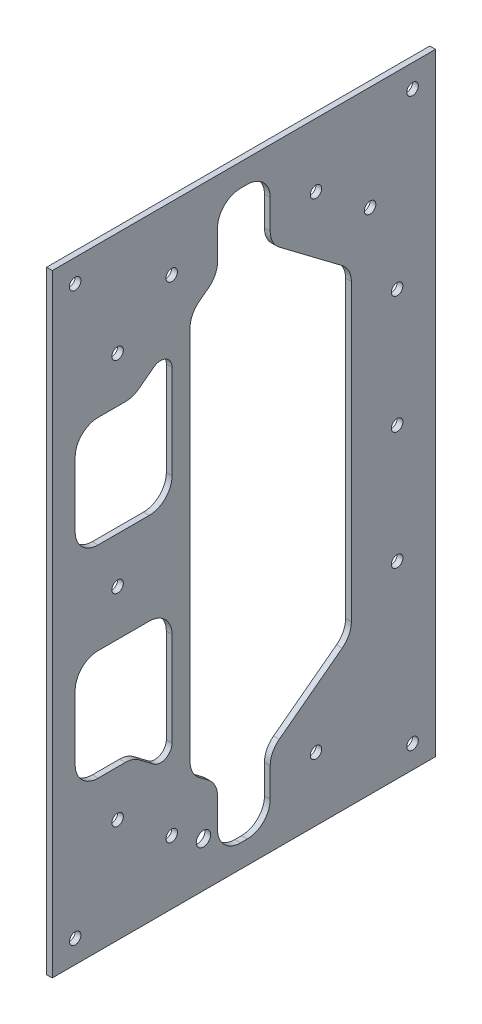
from build123d import *

# Parameters (mm, degrees)
SKETCH1_W           = 212.5
SKETCH1_H           = 339.725
SKETCH1_R           = 3.175
BOSS_EXTRUDE1_DEPTH = 3.175
CUT_EXTRUDE1_DEPTH  = 401.72360331
CUT_EXTRUDE2_DEPTH  = 13.97
BOSS_EXTRUDE2_START = -3.175
BOSS_EXTRUDE2_DEPTH = 3.175


with BuildPart() as part:
    # Sketch1 → Boss-Extrude1 (new body)
    with BuildSketch(Plane(origin=(0, 0, 0), x_dir=(0, 0, -1), z_dir=(1, 0, 0))):
        with Locations((106.25, -169.8625)):
            Rectangle(SKETCH1_W, SKETCH1_H)
        with Locations((12.7, -12.7)):
            Circle(SKETCH1_R, mode=Mode.SUBTRACT)
        with Locations((199.8, -12.7)):
            Circle(SKETCH1_R, mode=Mode.SUBTRACT)
        with Locations((66.25, -35.2425)):
            Circle(SKETCH1_R, mode=Mode.SUBTRACT)
        with Locations((146.25, -35.2425)):
            Circle(SKETCH1_R, mode=Mode.SUBTRACT)
        with Locations((176.25, -57.8625)):
            Circle(SKETCH1_R, mode=Mode.SUBTRACT)
        with Locations((36.25, -57.8625)):
            Circle(SKETCH1_R, mode=Mode.SUBTRACT)
        with Locations((191.25, -104.5325)):
            Circle(SKETCH1_R, mode=Mode.SUBTRACT)
        with Locations((36.25, -169.8625)):
            Circle(SKETCH1_R, mode=Mode.SUBTRACT)
        with Locations((191.25, -169.8625)):
            Circle(SKETCH1_R, mode=Mode.SUBTRACT)
        with Locations((36.25, -281.8625)):
            Circle(SKETCH1_R, mode=Mode.SUBTRACT)
        with Locations((66.25, -304.4825)):
            Circle(SKETCH1_R, mode=Mode.SUBTRACT)
        with Locations((12.7, -327.025)):
            Circle(SKETCH1_R, mode=Mode.SUBTRACT)
        with Locations((199.8, -327.025)):
            Circle(SKETCH1_R, mode=Mode.SUBTRACT)
        with Locations((146.25, -304.4825)):
            Circle(SKETCH1_R, mode=Mode.SUBTRACT)
        with Locations((191.25, -235.1925)):
            Circle(SKETCH1_R, mode=Mode.SUBTRACT)
    extrude(amount=BOSS_EXTRUDE1_DEPTH)

    # Sketch2 → Cut-Extrude1 (cut, through all)
    with BuildSketch(Plane(origin=(3.175, 0, 0), x_dir=(0, 0, -1), z_dir=(1, 0, 0))):
        with BuildLine():
            Line((165.85, -251.563304242), (165.85, -88.161695758))
            ThreePointArc((165.85, -88.161695758), (164.516472011, -82.49659964), (160.795934799, -78.021198677))
            Line((160.795934799, -78.021198677), (125.904065201, -51.712729))
            ThreePointArc((125.904065201, -51.712729), (122.183527989, -47.237328037), (120.85, -41.572231919))
            Line((120.85, -41.572231919), (120.85, -25.4))
            ThreePointArc((120.85, -25.4), (117.130256121, -16.419743879), (108.15, -12.7))
            Line((108.15, -12.7), (104.35, -12.7))
            ThreePointArc((104.35, -12.7), (95.369743879, -16.419743879), (91.65, -25.4))
            Line((91.65, -25.4), (91.65, -41.572231919))
            ThreePointArc((91.65, -41.572231919), (90.316472011, -47.237328037), (86.595934799, -51.712729))
            Line((86.595934799, -51.712729), (61.65, -70.521963839))
            Line((61.65, -70.521963839), (48.147303392, -80.702997081))
            ThreePointArc((48.147303392, -80.702997081), (44.532850149, -82.605637318), (40.501368593, -83.2625))
            Line((40.501368593, -83.2625), (25.4, -83.2625))
            ThreePointArc((25.4, -83.2625), (16.419743879, -86.982243879), (12.7, -95.9625))
            Line((12.7, -95.9625), (12.7, -131.7625))
            ThreePointArc((12.7, -131.7625), (16.419743879, -140.742756121), (25.4, -144.4625))
            Line((25.4, -144.4625), (48.95, -144.4625))
            ThreePointArc((48.95, -144.4625), (57.930256121, -148.182243879), (61.65, -157.1625))
            Line((61.65, -157.1625), (61.65, -182.5625))
            ThreePointArc((61.65, -182.5625), (57.930256121, -191.542756121), (48.95, -195.2625))
            Line((48.95, -195.2625), (25.4, -195.2625))
            ThreePointArc((25.4, -195.2625), (16.419743879, -198.982243879), (12.7, -207.9625))
            Line((12.7, -207.9625), (12.7, -243.7625))
            ThreePointArc((12.7, -243.7625), (16.419743879, -252.742756121), (25.4, -256.4625))
            Line((25.4, -256.4625), (40.501368593, -256.4625))
            ThreePointArc((40.501368593, -256.4625), (44.532850149, -257.119362682), (48.147303392, -259.022002919))
            Line((48.147303392, -259.022002919), (61.65, -269.203036161))
            Line((61.65, -269.203036161), (86.595934799, -288.012271))
            ThreePointArc((86.595934799, -288.012271), (90.316472011, -292.487671963), (91.65, -298.152768081))
            Line((91.65, -298.152768081), (91.65, -314.325))
            ThreePointArc((91.65, -314.325), (95.369743879, -323.305256121), (104.35, -327.025))
            Line((104.35, -327.025), (108.15, -327.025))
            ThreePointArc((108.15, -327.025), (117.130256121, -323.305256121), (120.85, -314.325))
            Line((120.85, -314.325), (120.85, -298.152768081))
            ThreePointArc((120.85, -298.152768081), (122.183527989, -292.487671963), (125.904065201, -288.012271))
            Line((125.904065201, -288.012271), (160.795934799, -261.703801323))
            ThreePointArc((160.795934799, -261.703801323), (164.516472011, -257.22840036), (165.85, -251.563304242))
        make_face()
    extrude(amount=-CUT_EXTRUDE1_DEPTH, mode=Mode.SUBTRACT)

    # Sketch3 → Cut-Extrude2 (cut)
    with BuildSketch(Plane.ZY):
        with BuildLine():
            ThreePointArc((-83.84305, -318.725), (-81.014622875, -317.553427125), (-79.84305, -314.725))
            ThreePointArc((-79.84305, -314.725), (-86.671477125, -311.896572875), (-83.84305, -318.725))
        make_face()
    extrude(amount=-CUT_EXTRUDE2_DEPTH, mode=Mode.SUBTRACT)

    # Sketch4 → Boss-Extrude2 (add)
    with BuildSketch(Plane.ZY.offset(BOSS_EXTRUDE2_START)):
        with BuildLine():
            Line((-76.43305, -65.705276058), (-76.43305, -274.019723942))
            ThreePointArc((-76.43305, -274.019723942), (-77.766577989, -279.68482006), (-81.487115201, -284.160221023))
            Line((-81.487115201, -284.160221023), (-56.2600826, -265.139038442))
            ThreePointArc((-56.2600826, -265.139038442), (-62.915598059, -265.752025907), (-66.43305, -260.068789901))
            Line((-66.43305, -260.068789901), (-66.43305, -207.9625))
            ThreePointArc((-66.43305, -207.9625), (-62.713306121, -198.982243879), (-53.73305, -195.2625))
            Line((-53.73305, -195.2625), (-48.95, -195.2625))
            ThreePointArc((-48.95, -195.2625), (-57.930256121, -191.542756121), (-61.65, -182.5625))
            Line((-61.65, -182.5625), (-61.65, -157.1625))
            ThreePointArc((-61.65, -157.1625), (-57.930256121, -148.182243879), (-48.95, -144.4625))
            Line((-48.95, -144.4625), (-53.73305, -144.4625))
            ThreePointArc((-53.73305, -144.4625), (-62.713306121, -140.742756121), (-66.43305, -131.7625))
            Line((-66.43305, -131.7625), (-66.43305, -79.656210099))
            ThreePointArc((-66.43305, -79.656210099), (-62.915598059, -73.972974093), (-56.2600826, -74.585961558))
            Line((-56.2600826, -74.585961558), (-81.487115201, -55.564778977))
            ThreePointArc((-81.487115201, -55.564778977), (-77.766577989, -60.04017994), (-76.43305, -65.705276058))
        make_face()
    extrude(amount=BOSS_EXTRUDE2_DEPTH)


solid = part.part
